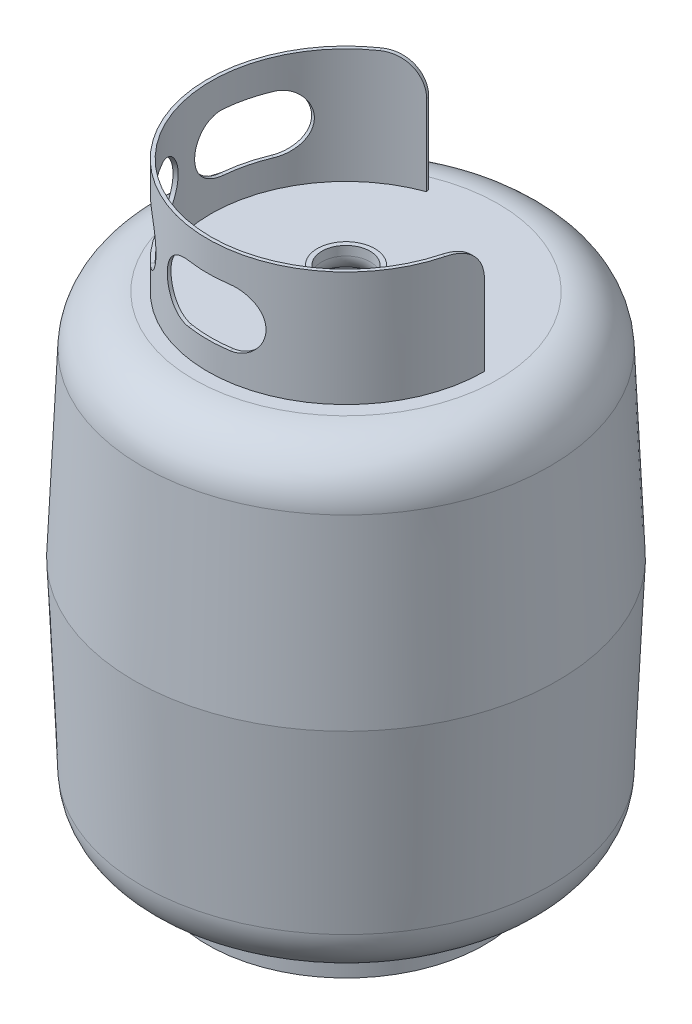
from build123d import *

# Parameters (mm, degrees)
SKETCH2_R           = 120.542830029
SKETCH2_R_2         = 117.542830029
BOSS_EXTRUDE1_DEPTH = 30
BOSS_EXTRUDE2_START = 100
BOSS_EXTRUDE2_DEPTH = 100
FILLET1_START       = -122
FILLET1_DEPTH       = 186.598862468
FILLET1_START_2     = -62.434186694
FILLET1_2_DEPTH     = 184.434186694
CUT_EXTRUDE1_DEPTH  = 567.14368039
CIRPATTERN1_COUNT   = 3
CIRPATTERN1_ANGLE   = 104


with BuildPart() as part:
    # Sketch1 → Revolve2 (revolve)
    with BuildSketch(Plane.XY, mode=Mode.PRIVATE) as revolve2_sk:
        with BuildLine():
            Line((0, 0), (0, 4))
            Line((0, 4), (-132.542830029, 4))
            ThreePointArc((-132.542830029, 4), (-160.894865316, 15.383077556), (-173.503807114, 43.211605118))
            Line((-173.503807114, 43.211605118), (-180.40391245, 201.25))
            Line((-180.40391245, 201.25), (-173.503807114, 359.288394882))
            ThreePointArc((-173.503807114, 359.288394882), (-160.894865316, 387.116922444), (-132.542830029, 398.5))
            Line((-132.542830029, 398.5), (-37, 398.5))
            ThreePointArc((-37, 398.5), (-25.686291501, 403.186291501), (-21, 414.5))
            Line((-21, 414.5), (-21, 422.5))
            Line((-21, 422.5), (-25, 422.5))
            Line((-25, 422.5), (-25, 414.5))
            ThreePointArc((-25, 414.5), (-28.514718626, 406.014718626), (-37, 402.5))
            Line((-37, 402.5), (-132.542830029, 402.5))
            ThreePointArc((-132.542830029, 402.5), (-163.660917539, 390.006378293), (-177.5, 359.462872431))
            Line((-177.5, 359.462872431), (-184.407723191, 201.25))
            Line((-184.407723191, 201.25), (-177.5, 43.037127569))
            ThreePointArc((-177.5, 43.037127569), (-163.660917539, 12.493621707), (-132.542830029, 0))
            Line((-132.542830029, 0), (0, 0))
        make_face()
    revolve(revolve2_sk.sketch.rotate(Axis((0, 402.5, 0), (0, -1, 0)), 270), axis=Axis((0, 402.5, 0), (0, -1, 0)))

    # Sketch2 → Boss-Extrude1 (add)
    with BuildSketch(Plane.XZ):
        with Locations(Location((0, 0, 0), (0, 0, 270))):
            Circle(SKETCH2_R)
        with Locations(Location((0, 0, 0), (0, 0, 270))):
            Circle(SKETCH2_R_2, mode=Mode.SUBTRACT)
    extrude(amount=BOSS_EXTRUDE1_DEPTH)

    # Sketch3 → Boss-Extrude2 (add)
    with BuildSketch(Plane(origin=(0, 402.5, 0), x_dir=(1, 0, 0), z_dir=(0, 1, 0)).offset(BOSS_EXTRUDE2_START)):
        with BuildLine():
            Line((-40.202015573, 110.454130004), (-41.228076003, 113.273207867))
            ThreePointArc((-41.228076003, 113.273207867), (-69.140526876, -98.742905642), (120.542830029, 0))
            Line((120.542830029, 0), (117.542830029, 0))
            ThreePointArc((117.542830029, 0), (-67.419797567, -96.28544951), (-40.202015573, 110.454130004))
        make_face()
    extrude(amount=-BOSS_EXTRUDE2_DEPTH)

    # Fillet1: read off the stored shape, not the designer's step
    # Fillet1 outline → Fillet1 (cut)
    with BuildSketch(Plane(origin=(0, 0, 0), x_dir=(0.9396926207859082, 0, -0.3420201433256691), z_dir=(0.3420201433256691, 0, 0.9396926207859083)).offset(FILLET1_START)):
        with BuildLine():
            ThreePointArc((-30, 502.5), (-8.786796564, 493.713203436), (0, 472.5))
            Line((0, 472.5), (0, 502.5))
            Line((0, 502.5), (-30, 502.5))
        make_face()
    extrude(amount=FILLET1_DEPTH, mode=Mode.SUBTRACT)

    # Fillet1 2 outline → Fillet1 2 (cut)
    with BuildSketch(Plane.YZ.offset(FILLET1_START_2)):
        with BuildLine():
            ThreePointArc((502.5, 30), (493.713203436, 8.786796564), (472.5, 0))
            Line((472.5, 0), (502.5, 0))
            Line((502.5, 0), (502.5, 30))
        make_face()
    extrude(amount=FILLET1_2_DEPTH, mode=Mode.SUBTRACT)

    # Sketch4 → Cut-Extrude1 (cut, through all)
    with BuildSketch(Plane.XY):
        with BuildLine():
            Line((-18, 476.569146514), (18, 476.569146514))
            ThreePointArc((18, 476.569146514), (43, 451.569146514), (18, 426.569146514))
            Line((18, 426.569146514), (-18, 426.569146514))
            ThreePointArc((-18, 426.569146514), (-43, 451.569146514), (-18, 476.569146514))
        make_face()
    cut_extrude1 = extrude(amount=CUT_EXTRUDE1_DEPTH, mode=Mode.SUBTRACT)

    # CirPattern1: Cut-Extrude1 ×3 about axis
    cirpattern1_axis = Axis((0, 502.5, 0), (0, -1, 0))
    for i in range(1, CIRPATTERN1_COUNT):
        add(cut_extrude1.rotate(cirpattern1_axis, i * CIRPATTERN1_ANGLE / (CIRPATTERN1_COUNT - 1)), mode=Mode.SUBTRACT)


solid = part.part
